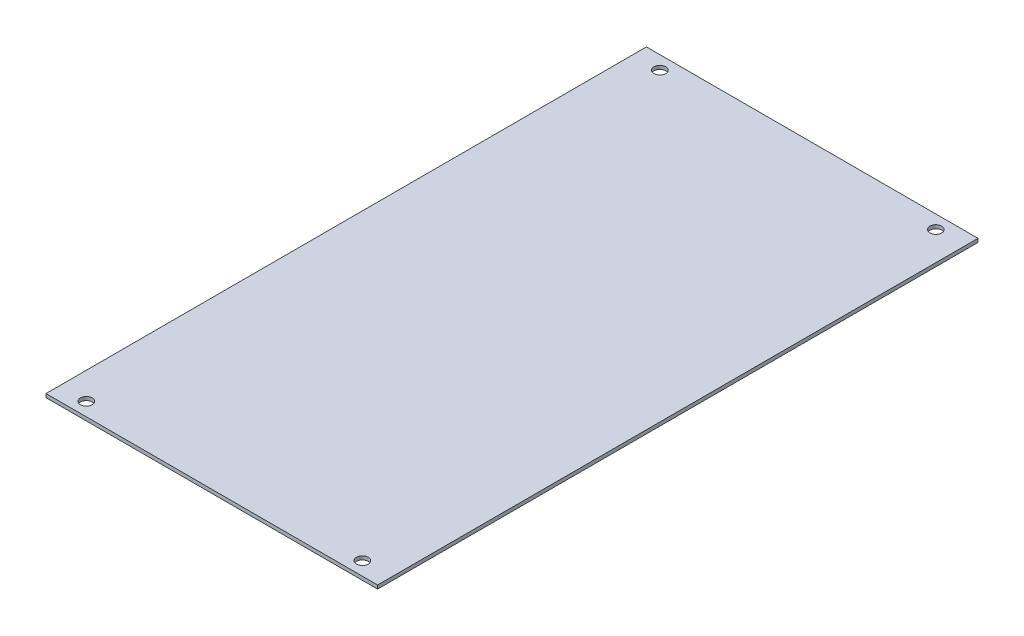
from build123d import *

# Parameters (mm, degrees)
SKIZZE2_W                = 185
SKIZZE2_H                = 335
BASIS_BLECH1_DEPTH       = 2
DURCHGANGSLOCH_F_R_M61_D = 6.6


# Sheet-metal steps are written as plain solids
with BuildPart() as part:
    # Skizze2 → Basis-Blech1 (new body)
    with BuildSketch(Plane(origin=(0, 0, 0), x_dir=(1, 0, 0), z_dir=(0, 1, 0))):
        Rectangle(SKIZZE2_W, SKIZZE2_H)
    extrude(amount=-BASIS_BLECH1_DEPTH)

    # Durchgangsloch für M61 (through all)
    with Locations(Plane(origin=(0, -2, 0), x_dir=(-1, 0, 0), z_dir=(0, -1, 0))):
        with Locations((-76.5, -160), (77.5, -160), (77.5, 160), (-76.5, 160)):
            Hole(DURCHGANGSLOCH_F_R_M61_D / 2)


solid = part.part
